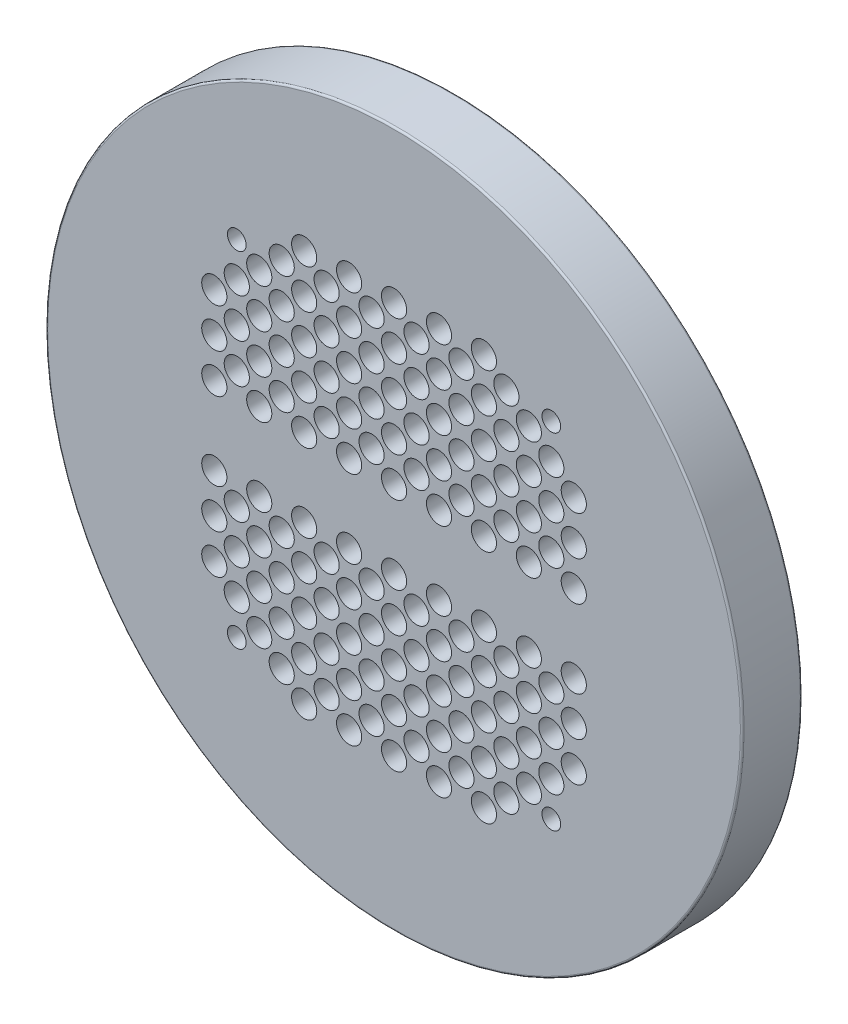
from build123d import *

# Parameters (mm, degrees)
SKETCH1_R               = 295.275
BOSS_EXTRUDE1_DEPTH     = 50.8
FILLET2_R               = 1.5875
CUT_EXTRUDE4_DEPTH      = 421.660541659
CUT_EXTRUDE4_DEPTH_BACK = 421.660541659
SKETCH11_R              = 10.668
SKETCH11_R_2            = 7.9375


with BuildPart() as part:
    # Sketch1 → Boss-Extrude1 (new body)
    with BuildSketch(Plane.XY):
        Circle(SKETCH1_R)
    extrude(amount=BOSS_EXTRUDE1_DEPTH)

    # Fillet2
    fillet2_edges = [part.edges().sort_by_distance(p)[0] for p in [
        (-295.275, 0, 50.8),
        (-295.275, 0, 0),
    ]]
    fillet(fillet2_edges, radius=FILLET2_R)

    # Sketch11 → Cut-Extrude4 (cut, two sides: drawn at the far end of the back side and taken through both)
    with BuildSketch(Plane.XY.offset(-CUT_EXTRUDE4_DEPTH_BACK)):
        with Locations((0, 33.02)):
            Circle(SKETCH11_R)
        with Locations((38.1, 33.02)):
            Circle(SKETCH11_R)
        with Locations((76.2, 33.02)):
            Circle(SKETCH11_R)
        with Locations((114.3, 33.02)):
            Circle(SKETCH11_R)
        with Locations((152.4, 33.02)):
            Circle(SKETCH11_R)
        with Locations((-38.1, 33.02)):
            Circle(SKETCH11_R)
        with Locations((-76.2, 33.02)):
            Circle(SKETCH11_R)
        with Locations((-114.3, 33.02)):
            Circle(SKETCH11_R)
        with Locations((-152.4, 33.02)):
            Circle(SKETCH11_R)
        with Locations((0, 66.3575)):
            Circle(SKETCH11_R)
        with Locations((38.1, 66.3575)):
            Circle(SKETCH11_R)
        with Locations((76.2, 66.3575)):
            Circle(SKETCH11_R)
        with Locations((114.3, 66.3575)):
            Circle(SKETCH11_R)
        with Locations((152.4, 66.3575)):
            Circle(SKETCH11_R)
        with Locations((-38.1, 66.3575)):
            Circle(SKETCH11_R)
        with Locations((-76.2, 66.3575)):
            Circle(SKETCH11_R)
        with Locations((-114.3, 66.3575)):
            Circle(SKETCH11_R)
        with Locations((-152.4, 66.3575)):
            Circle(SKETCH11_R)
        with Locations((0, 99.695)):
            Circle(SKETCH11_R)
        with Locations((38.1, 99.695)):
            Circle(SKETCH11_R)
        with Locations((76.2, 99.695)):
            Circle(SKETCH11_R)
        with Locations((114.3, 99.695)):
            Circle(SKETCH11_R)
        with Locations((152.4, 99.695)):
            Circle(SKETCH11_R)
        with Locations((-38.1, 99.695)):
            Circle(SKETCH11_R)
        with Locations((-76.2, 99.695)):
            Circle(SKETCH11_R)
        with Locations((-114.3, 99.695)):
            Circle(SKETCH11_R)
        with Locations((-133.35, 146.05)):
            Circle(SKETCH11_R_2)
        with Locations((-152.4, 99.695)):
            Circle(SKETCH11_R)
        with Locations((0, 133.0325)):
            Circle(SKETCH11_R)
        with Locations((38.1, 133.0325)):
            Circle(SKETCH11_R)
        with Locations((76.2, 133.0325)):
            Circle(SKETCH11_R)
        with Locations((114.3, 133.0325)):
            Circle(SKETCH11_R)
        with Locations((-38.1, 133.0325)):
            Circle(SKETCH11_R)
        with Locations((-76.2, 133.0325)):
            Circle(SKETCH11_R)
        with Locations((-114.3, 133.0325)):
            Circle(SKETCH11_R)
        with Locations((0, 166.37)):
            Circle(SKETCH11_R)
        with Locations((38.1, 166.37)):
            Circle(SKETCH11_R)
        with Locations((76.2, 166.37)):
            Circle(SKETCH11_R)
        with Locations((-38.1, 166.37)):
            Circle(SKETCH11_R)
        with Locations((-76.2, 166.37)):
            Circle(SKETCH11_R)
        with Locations((19.05, 49.8475)):
            Circle(SKETCH11_R)
        with Locations((-19.05, 49.8475)):
            Circle(SKETCH11_R)
        with Locations((-57.15, 49.8475)):
            Circle(SKETCH11_R)
        with Locations((-95.25, 49.8475)):
            Circle(SKETCH11_R)
        with Locations((-133.35, 49.8475)):
            Circle(SKETCH11_R)
        with Locations((57.15, 49.8475)):
            Circle(SKETCH11_R)
        with Locations((95.25, 49.8475)):
            Circle(SKETCH11_R)
        with Locations((133.35, 49.8475)):
            Circle(SKETCH11_R)
        with Locations((19.05, 83.185)):
            Circle(SKETCH11_R)
        with Locations((-19.05, 83.185)):
            Circle(SKETCH11_R)
        with Locations((-57.15, 83.185)):
            Circle(SKETCH11_R)
        with Locations((-95.25, 83.185)):
            Circle(SKETCH11_R)
        with Locations((-133.35, 83.185)):
            Circle(SKETCH11_R)
        with Locations((57.15, 83.185)):
            Circle(SKETCH11_R)
        with Locations((95.25, 83.185)):
            Circle(SKETCH11_R)
        with Locations((133.35, 83.185)):
            Circle(SKETCH11_R)
        with Locations((19.05, 116.5225)):
            Circle(SKETCH11_R)
        with Locations((-19.05, 116.5225)):
            Circle(SKETCH11_R)
        with Locations((-57.15, 116.5225)):
            Circle(SKETCH11_R)
        with Locations((-95.25, 116.5225)):
            Circle(SKETCH11_R)
        with Locations((-133.35, 116.5225)):
            Circle(SKETCH11_R)
        with Locations((57.15, 116.5225)):
            Circle(SKETCH11_R)
        with Locations((95.25, 116.5225)):
            Circle(SKETCH11_R)
        with Locations((133.35, 116.5225)):
            Circle(SKETCH11_R)
        with Locations((19.05, 149.86)):
            Circle(SKETCH11_R)
        with Locations((-19.05, 149.86)):
            Circle(SKETCH11_R)
        with Locations((-57.15, 149.86)):
            Circle(SKETCH11_R)
        with Locations((-95.25, 149.86)):
            Circle(SKETCH11_R)
        with Locations((57.15, 149.86)):
            Circle(SKETCH11_R)
        with Locations((95.25, 149.86)):
            Circle(SKETCH11_R)
        with Locations((-133.35, -146.05)):
            Circle(SKETCH11_R_2)
        with Locations((133.35, -146.05)):
            Circle(SKETCH11_R_2)
        with Locations((133.35, 146.05)):
            Circle(SKETCH11_R_2)
        with Locations((95.25, -149.86)):
            Circle(SKETCH11_R)
        with Locations((57.15, -149.86)):
            Circle(SKETCH11_R)
        with Locations((-95.25, -149.86)):
            Circle(SKETCH11_R)
        with Locations((-57.15, -149.86)):
            Circle(SKETCH11_R)
        with Locations((-19.05, -149.86)):
            Circle(SKETCH11_R)
        with Locations((19.05, -149.86)):
            Circle(SKETCH11_R)
        with Locations((133.35, -116.5225)):
            Circle(SKETCH11_R)
        with Locations((95.25, -116.5225)):
            Circle(SKETCH11_R)
        with Locations((57.15, -116.5225)):
            Circle(SKETCH11_R)
        with Locations((-133.35, -116.5225)):
            Circle(SKETCH11_R)
        with Locations((-95.25, -116.5225)):
            Circle(SKETCH11_R)
        with Locations((-57.15, -116.5225)):
            Circle(SKETCH11_R)
        with Locations((-19.05, -116.5225)):
            Circle(SKETCH11_R)
        with Locations((19.05, -116.5225)):
            Circle(SKETCH11_R)
        with Locations((133.35, -83.185)):
            Circle(SKETCH11_R)
        with Locations((95.25, -83.185)):
            Circle(SKETCH11_R)
        with Locations((57.15, -83.185)):
            Circle(SKETCH11_R)
        with Locations((-133.35, -83.185)):
            Circle(SKETCH11_R)
        with Locations((-95.25, -83.185)):
            Circle(SKETCH11_R)
        with Locations((-57.15, -83.185)):
            Circle(SKETCH11_R)
        with Locations((-19.05, -83.185)):
            Circle(SKETCH11_R)
        with Locations((19.05, -83.185)):
            Circle(SKETCH11_R)
        with Locations((133.35, -49.8475)):
            Circle(SKETCH11_R)
        with Locations((95.25, -49.8475)):
            Circle(SKETCH11_R)
        with Locations((57.15, -49.8475)):
            Circle(SKETCH11_R)
        with Locations((-133.35, -49.8475)):
            Circle(SKETCH11_R)
        with Locations((-95.25, -49.8475)):
            Circle(SKETCH11_R)
        with Locations((-57.15, -49.8475)):
            Circle(SKETCH11_R)
        with Locations((-19.05, -49.8475)):
            Circle(SKETCH11_R)
        with Locations((19.05, -49.8475)):
            Circle(SKETCH11_R)
        with Locations((-76.2, -166.37)):
            Circle(SKETCH11_R)
        with Locations((-38.1, -166.37)):
            Circle(SKETCH11_R)
        with Locations((76.2, -166.37)):
            Circle(SKETCH11_R)
        with Locations((38.1, -166.37)):
            Circle(SKETCH11_R)
        with Locations((0, -166.37)):
            Circle(SKETCH11_R)
        with Locations((-114.3, -133.0325)):
            Circle(SKETCH11_R)
        with Locations((-76.2, -133.0325)):
            Circle(SKETCH11_R)
        with Locations((-38.1, -133.0325)):
            Circle(SKETCH11_R)
        with Locations((114.3, -133.0325)):
            Circle(SKETCH11_R)
        with Locations((76.2, -133.0325)):
            Circle(SKETCH11_R)
        with Locations((38.1, -133.0325)):
            Circle(SKETCH11_R)
        with Locations((0, -133.0325)):
            Circle(SKETCH11_R)
        with Locations((-152.4, -99.695)):
            Circle(SKETCH11_R)
        with Locations((-114.3, -99.695)):
            Circle(SKETCH11_R)
        with Locations((-76.2, -99.695)):
            Circle(SKETCH11_R)
        with Locations((-38.1, -99.695)):
            Circle(SKETCH11_R)
        with Locations((152.4, -99.695)):
            Circle(SKETCH11_R)
        with Locations((114.3, -99.695)):
            Circle(SKETCH11_R)
        with Locations((76.2, -99.695)):
            Circle(SKETCH11_R)
        with Locations((38.1, -99.695)):
            Circle(SKETCH11_R)
        with Locations((0, -99.695)):
            Circle(SKETCH11_R)
        with Locations((-152.4, -66.3575)):
            Circle(SKETCH11_R)
        with Locations((-114.3, -66.3575)):
            Circle(SKETCH11_R)
        with Locations((-76.2, -66.3575)):
            Circle(SKETCH11_R)
        with Locations((-38.1, -66.3575)):
            Circle(SKETCH11_R)
        with Locations((152.4, -66.3575)):
            Circle(SKETCH11_R)
        with Locations((114.3, -66.3575)):
            Circle(SKETCH11_R)
        with Locations((76.2, -66.3575)):
            Circle(SKETCH11_R)
        with Locations((38.1, -66.3575)):
            Circle(SKETCH11_R)
        with Locations((0, -66.3575)):
            Circle(SKETCH11_R)
        with Locations((-152.4, -33.02)):
            Circle(SKETCH11_R)
        with Locations((-114.3, -33.02)):
            Circle(SKETCH11_R)
        with Locations((-76.2, -33.02)):
            Circle(SKETCH11_R)
        with Locations((-38.1, -33.02)):
            Circle(SKETCH11_R)
        with Locations((152.4, -33.02)):
            Circle(SKETCH11_R)
        with Locations((114.3, -33.02)):
            Circle(SKETCH11_R)
        with Locations((76.2, -33.02)):
            Circle(SKETCH11_R)
        with Locations((38.1, -33.02)):
            Circle(SKETCH11_R)
        with Locations((0, -33.02)):
            Circle(SKETCH11_R)
    extrude(amount=CUT_EXTRUDE4_DEPTH + CUT_EXTRUDE4_DEPTH_BACK, mode=Mode.SUBTRACT)


solid = part.part
